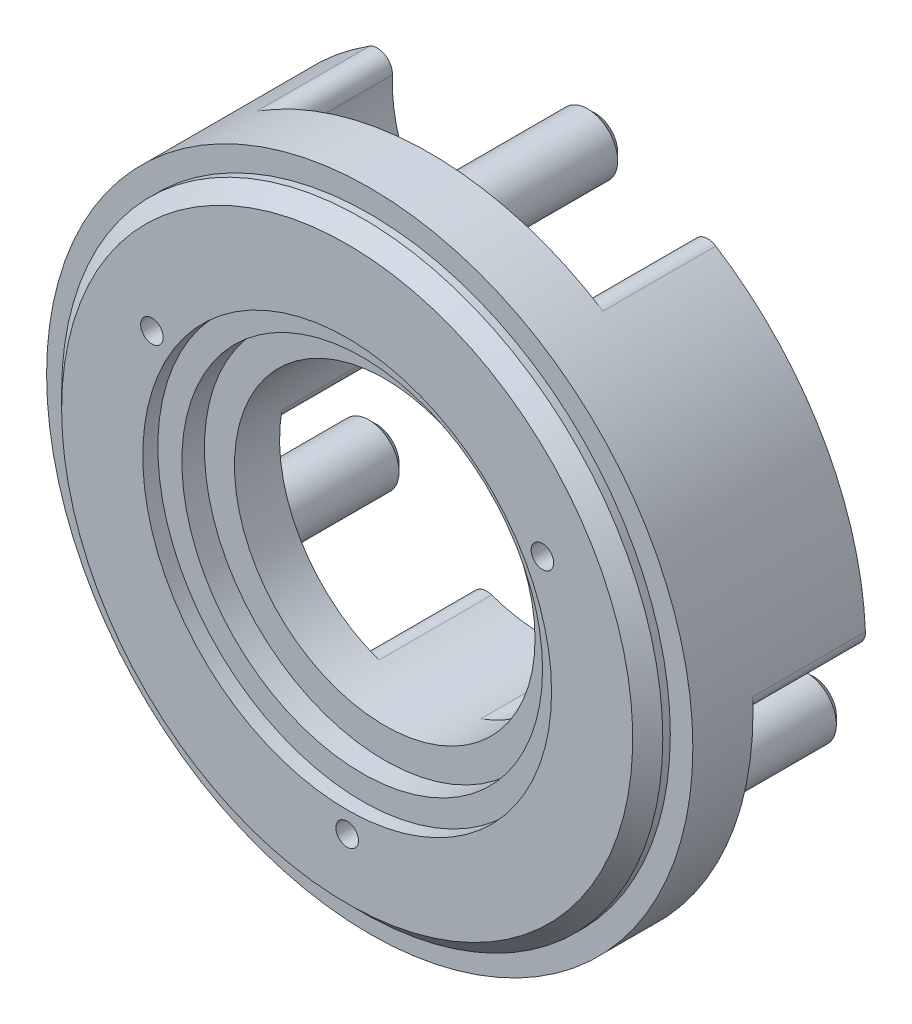
from build123d import *

# Parameters (mm, degrees)
SKETCH4_R                    = 4
BOSS_EXTRUDE1_DEPTH          = 0.5
SKETCH5_R                    = 2
BOSS_EXTRUDE2_DEPTH          = 10.5
CHAMFER1_SIZE                = 0.5
CIRPATTERN1_COUNT            = 3
CHAMFER1_OF_CIRPATTERN1_SIZE = 0.5
BOSS_EXTRUDE3_DEPTH          = 7.5
SKETCH7_R                    = 0.75
CUT_EXTRUDE1_DEPTH           = 2
CUT_EXTRUDE2_DEPTH           = 34.068111528
CHAMFER2_SIZE                = 0.2
CHAMFER3_SIZE                = 0.5
CIRPATTERN2_COUNT            = 3
CHAMFER2_OF_CIRPATTERN2_SIZE = 0.2
CHAMFER3_OF_CIRPATTERN2_SIZE = 0.5
CHAMFER4_SIZE                = 1
FILLET1_R                    = 1


with BuildPart() as part:
    # Sketch3 → Revolve1 (revolve)
    with BuildSketch(Plane(origin=(0, 0, 0), x_dir=(0, 0, -1), z_dir=(1, 0, 0)), mode=Mode.PRIVATE) as revolve1_sk:
        Polygon((1, 13.6), (1, 12), (2.5, 12), (2.5, 10), (5.5, 10), (5.5, 21.5), (1.5, 21.5), (1.5, 20), (0, 20), (0, 13.6), align=None)
    revolve(revolve1_sk.sketch.rotate(Axis((0, 0, 0), (0, 0, -1)), 90), axis=Axis((0, 0, 0), (0, 0, -1)))

    # Sketch4 → Boss-Extrude1 (add)
    with BuildSketch(Plane(origin=(0, 0, -5.5), x_dir=(-1, 0, 0), z_dir=(0, 0, -1))):
        with Locations(Location((0, 16.8, 0), (0, 0, 180))):
            Circle(SKETCH4_R)
    boss_extrude1 = extrude(amount=BOSS_EXTRUDE1_DEPTH)

    # Sketch5 → Boss-Extrude2 (add)
    with BuildSketch(Plane(origin=(0, 0, -6), x_dir=(-1, 0, 0), z_dir=(0, 0, -1))):
        with Locations(Location((0, 16.8, 0), (0, 0, 180))):
            Circle(SKETCH5_R)
    boss_extrude2 = extrude(amount=BOSS_EXTRUDE2_DEPTH)

    # Chamfer1
    chamfer1_edges = [part.edges().sort_by_distance(p)[0] for p in [
        (-2, 16.8, -16.5),
    ]]
    chamfer(chamfer1_edges, length=CHAMFER1_SIZE)

    # CirPattern1: Boss-Extrude1, Boss-Extrude2 ×3 about axis
    cirpattern1_axis = Axis((0, 0, 0), (0, 0, 1))
    add([boss_extrude1.rotate(cirpattern1_axis, i * 360 / CIRPATTERN1_COUNT) for i in range(1, CIRPATTERN1_COUNT)])
    add([boss_extrude2.rotate(cirpattern1_axis, i * 360 / CIRPATTERN1_COUNT) for i in range(1, CIRPATTERN1_COUNT)])

    # Chamfer1 of CirPattern1
    chamfer1_of_cirpattern1_edges = [part.edges().sort_by_distance(p)[0] for p in [
        (-13.549226784, -10.132050808, -16.5),
        (15.549226784, -6.667949192, -16.5),
    ]]
    chamfer(chamfer1_of_cirpattern1_edges, length=CHAMFER1_OF_CIRPATTERN1_SIZE)

    # Sketch6 → Boss-Extrude3 (add)
    with BuildSketch(Plane(origin=(0, 0, -5.5), x_dir=(-1, 0, 0), z_dir=(0, 0, -1))):
        with BuildLine():
            ThreePointArc((-4.561681399, -8.89893605), (-6.703398823, -14.60024061), (-11.755277198, -18.001762636))
            ThreePointArc((-11.755277198, -18.001762636), (0, -21.5), (11.755277198, -18.001762636))
            ThreePointArc((11.755277198, -18.001762636), (6.703398823, -14.60024061), (4.561681399, -8.89893605))
            ThreePointArc((4.561681399, -8.89893605), (0, -10), (-4.561681399, -8.89893605))
        make_face()
    boss_extrude3 = extrude(amount=BOSS_EXTRUDE3_DEPTH)

    # Sketch7 → Cut-Extrude1 (cut)
    with BuildSketch(Plane(origin=(0, 0, -13), x_dir=(-1, 0, 0), z_dir=(0, 0, -1))):
        with BuildLine():
            Line((-3.105828541, -11.591109915), (-4.658742812, -17.386664873))
            ThreePointArc((-4.658742812, -17.386664873), (0, -18), (4.658742812, -17.386664873))
            Line((4.658742812, -17.386664873), (3.105828541, -11.591109915))
            ThreePointArc((3.105828541, -11.591109915), (0, -12), (-3.105828541, -11.591109915))
        make_face()
        with Locations((0, -15)):
            Circle(SKETCH7_R, mode=Mode.SUBTRACT)
    cut_extrude1 = extrude(amount=-CUT_EXTRUDE1_DEPTH, mode=Mode.SUBTRACT)

    # Sketch7<3> → Cut-Extrude2 (cut, through all)
    with BuildSketch(Plane(origin=(0, 0, -13), x_dir=(-1, 0, 0), z_dir=(0, 0, -1))):
        with BuildLine():
            ThreePointArc((0.75, -15), (0.530330086, -14.469669914), (0, -14.25))
            Line((0, -14.25), (0, -15.75))
            ThreePointArc((0, -15.75), (0.530330086, -15.530330086), (0.75, -15))
        make_face()
        with BuildLine():
            Line((0, -15.75), (0, -14.25))
            ThreePointArc((0, -14.25), (-0.75, -15), (0, -15.75))
        make_face()
    cut_extrude2 = extrude(amount=-CUT_EXTRUDE2_DEPTH, mode=Mode.SUBTRACT)

    # Chamfer2
    chamfer2_edges = [part.edges().sort_by_distance(p)[0] for p in [
        (0, -15.75, -11),
    ]]
    chamfer(chamfer2_edges, length=CHAMFER2_SIZE)

    # Chamfer3
    chamfer3_edges = [part.edges().sort_by_distance(p)[0] for p in [
        (0, -12, -13),
        (3.882285677, -14.488887394, -13),
        (0, -18, -13),
        (-3.882285677, -14.488887394, -13),
    ]]
    chamfer(chamfer3_edges, length=CHAMFER3_SIZE)

    # CirPattern2: Boss-Extrude3, Cut-Extrude1, Cut-Extrude2 ×3 about axis
    cirpattern2_axis = Axis((0, 0, 0), (0, 0, 1))
    add([boss_extrude3.rotate(cirpattern2_axis, i * 360 / CIRPATTERN2_COUNT) for i in range(1, CIRPATTERN2_COUNT)])
    add([cut_extrude1.rotate(cirpattern2_axis, i * 360 / CIRPATTERN2_COUNT) for i in range(1, CIRPATTERN2_COUNT)], mode=Mode.SUBTRACT)
    add([cut_extrude2.rotate(cirpattern2_axis, i * 360 / CIRPATTERN2_COUNT) for i in range(1, CIRPATTERN2_COUNT)], mode=Mode.SUBTRACT)

    # Chamfer2 of CirPattern2
    chamfer2_of_cirpattern2_edges = [part.edges().sort_by_distance(p)[0] for p in [
        (13.63990011, 7.875, -11),
        (-13.63990011, 7.875, -11),
    ]]
    chamfer(chamfer2_of_cirpattern2_edges, length=CHAMFER2_OF_CIRPATTERN2_SIZE)

    # Chamfer3 of CirPattern2
    chamfer3_of_cirpattern2_edges = [part.edges().sort_by_distance(p)[0] for p in [
        (10.392304845, 6, -13),
        (10.606601718, 10.606601718, -13),
        (15.588457268, 9, -13),
        (14.488887394, 3.882285677, -13),
        (-10.392304845, 6, -13),
        (-14.488887394, 3.882285677, -13),
        (-15.588457268, 9, -13),
        (-10.606601718, 10.606601718, -13),
    ]]
    chamfer(chamfer3_of_cirpattern2_edges, length=CHAMFER3_OF_CIRPATTERN2_SIZE)

    # Chamfer4
    chamfer4_edges = [part.edges().sort_by_distance(p)[0] for p in [
        (-20, 0, 0),
    ]]
    chamfer(chamfer4_edges, length=CHAMFER4_SIZE)

    # Fillet1
    # the kernel refuses this fillet: 1 mm, written as the material it takes off along each edge
    with BuildSketch(Plane(origin=(21.467622355, -1.179487364, -5.5), x_dir=(0.006387197521753026, 0.9999796016458627, 0), z_dir=(0, 0, -1)), Plane(origin=(-9.712345156, 19.18125, -5.5), x_dir=(-0.8692013370524359, -0.4944583255101058, 0), z_dir=(0, 0, -1)), Plane(origin=(-11.755277198, -18.001762636, -5.5), x_dir=(0.8628141395306828, -0.5055212761357604, 0), z_dir=(0, 0, -1))) as fillet1_piece_1:
        with BuildLine():
            CenterArc((2.036209541, -0.998824096), FILLET1_R, 87.221143718, 125.050734124)
            ThreePointArc((1.190685537, -1.532761506), (0.632617432, -0.737424909), (0, 0))
            ThreePointArc((0, 0), (1.04234536, 0.025281931), (2.084690721, 0))
        make_face()
    extrude(amount=12.711726802, mode=Mode.SUBTRACT)
    with BuildSketch(Plane(origin=(9.987545385, 0.49893605, -5.5), x_dir=(0.917317562643698, 0.39815636283428313, 0), z_dir=(0, 0, -1)), Plane(origin=(-5.425863987, 8.4, -5.5), x_dir=(-0.8034723062147525, 0.5953421311699238, 0), z_dir=(0, 0, -1)), Plane(origin=(-4.561681399, -8.89893605, -5.5), x_dir=(-0.113845256428944, -0.9934984940042073, 0), z_dir=(0, 0, -1))) as fillet1_piece_2:
        with BuildLine():
            CenterArc((1.346819148, -0.99794128), FILLET1_R, 93.677145319, 99.571657965)
            ThreePointArc((0.373435102, -1.22712134), (0.20641295, -0.607567006), (0, 0))
            ThreePointArc((0, 0), (0.641342451, -0.020587199), (1.282684903, 0))
        make_face()
    extrude(amount=10.706712257, mode=Mode.SUBTRACT)
    with BuildSketch(Plane(origin=(5.425863987, 8.4, -5.5), x_dir=(0.8034723062147446, 0.5953421311699345, 0), z_dir=(0, 0, -1)), Plane(origin=(-9.987545385, 0.49893605, -5.5), x_dir=(-0.9173175626437023, 0.3981563628342732, 0), z_dir=(0, 0, -1)), Plane(origin=(4.561681399, -8.89893605, -5.5), x_dir=(0.11384525642895783, -0.9934984940042058, 0), z_dir=(0, 0, -1))) as fillet1_piece_3:
        with BuildLine():
            CenterArc((1.346819148, 0.99794128), FILLET1_R, 166.751196715, 99.571657965)
            ThreePointArc((0.373435102, 1.22712134), (0.20641295, 0.607567006), (0, 0))
            ThreePointArc((0, 0), (0.641342451, 0.020587199), (1.282684903, 0))
        make_face()
    extrude(amount=10.706712257, mode=Mode.SUBTRACT)
    with BuildSketch(Plane(origin=(9.712345156, 19.18125, -5.5), x_dir=(0.8692013370524442, -0.49445832551009133, 0), z_dir=(0, 0, -1)), Plane(origin=(-21.467622355, -1.179487364, -5.5), x_dir=(-0.006387197521764941, 0.9999796016458625, 0), z_dir=(0, 0, -1)), Plane(origin=(11.755277198, -18.001762636, -5.5), x_dir=(-0.8628141395306764, -0.5055212761357711, 0), z_dir=(0, 0, -1))) as fillet1_piece_4:
        with BuildLine():
            CenterArc((2.036209541, 0.998824096), FILLET1_R, 147.728122158, 125.050734124)
            ThreePointArc((1.190685537, 1.532761506), (0.632617432, 0.737424909), (0, 0))
            ThreePointArc((0, 0), (1.04234536, -0.025281931), (2.084690721, 0))
        make_face()
    extrude(amount=12.711726802, mode=Mode.SUBTRACT)


solid = part.part
